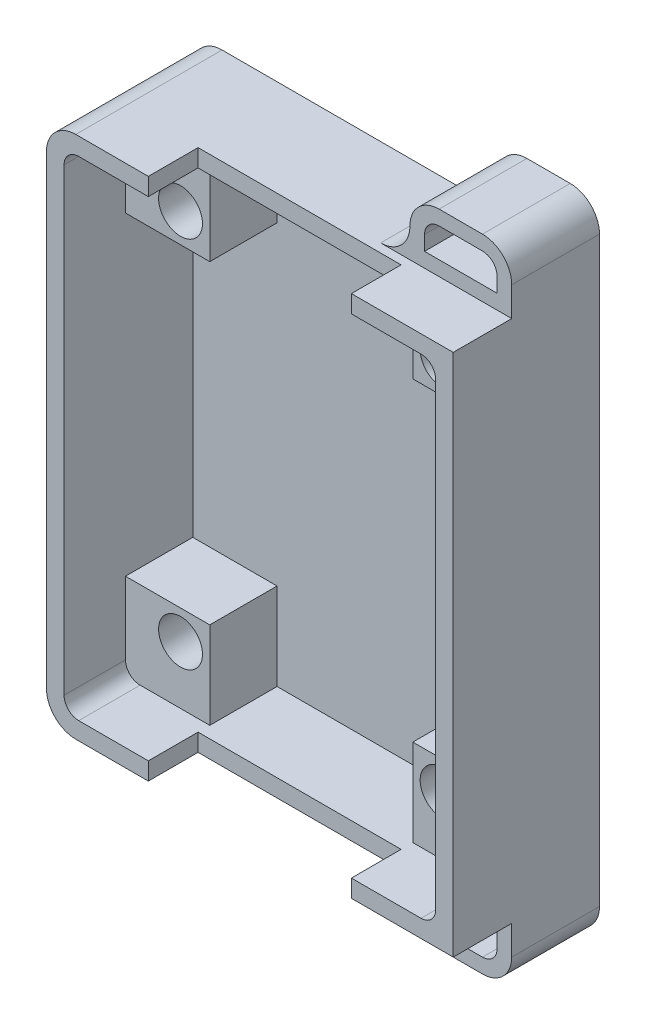
from build123d import *

# Parameters (mm, degrees)
SKIZZE1_W         = 27.8
SKIZZE1_H         = 35.8
EXTRUSION1_DEPTH  = 12
SKIZZE2_W         = 25.4
SKIZZE2_H         = 33.4
EXTRUSION2_DEPTH  = 10.8
SKIZZE3_R         = 1.5
EXTRUSION3_DEPTH  = 10.8
EXTRUSION4_START  = 6.6
SKIZZE4_W         = 5.76
SKIZZE4_H         = 5.95
SKIZZE4_R         = 1.5
EXTRUSION4_DEPTH  = 6.6
SKIZZE5_W         = 13.88
SKIZZE5_H         = 3.4
EXTRUSION5_DEPTH  = 47.887951544
EXTRUSION6_DEPTH  = 2
SKIZZE7_W         = 27.8
SKIZZE7_H         = 35.8
EXTRUSION7_DEPTH  = 2
SKIZZE8_W         = 6.96
SKIZZE8_H         = 6
EXTRUSION8_DEPTH  = 4
SKIZZE9_W         = 4.96
SKIZZE9_H         = 2
EXTRUSION9_DEPTH  = 50.566924456
SKIZZE10_W        = 6.96
SKIZZE10_H        = 4
SKIZZE10_W_2      = 4.96
SKIZZE10_H_2      = 2
EXTRUSION10_DEPTH = 6
RUNDUNG1_R        = 2
RUNDUNG2_R        = 1
RUNDUNG3_R        = 1
SKIZZE11_R        = 1.5
EXTRUSION11_DEPTH = 10


with BuildPart() as part:
    # Skizze1 → Extrusion1 (new body)
    with BuildSketch(Plane.XY):
        with Locations((13.9, -17.9)):
            Rectangle(SKIZZE1_W, SKIZZE1_H)
    extrude(amount=EXTRUSION1_DEPTH)

    # Skizze2 → Extrusion2 (cut)
    with BuildSketch(Plane.XY.offset(12)):
        with Locations((13.9, -17.9)):
            Rectangle(SKIZZE2_W, SKIZZE2_H)
    extrude(amount=-EXTRUSION2_DEPTH, mode=Mode.SUBTRACT)

    # Skizze3 → Extrusion3 (cut)
    with BuildSketch(Plane.XY.offset(1.2)):
        with Locations((22.84, -30.65)):
            Circle(SKIZZE3_R)
        with Locations((4.96, -30.65)):
            Circle(SKIZZE3_R)
        with Locations((22.84, -5.15)):
            Circle(SKIZZE3_R)
        with Locations((4.96, -5.15)):
            Circle(SKIZZE3_R)
    extrude(amount=-EXTRUSION3_DEPTH, mode=Mode.SUBTRACT)

    # Skizze4 → Extrusion4 (add)
    # profile 1 of 4: a face of its own
    with BuildSketch(Plane.XY.offset(1.2).offset(EXTRUSION4_START)):
        with Locations((4.08, -4.175)):
            Rectangle(SKIZZE4_W, SKIZZE4_H)
        with Locations((4.96, -5.15)):
            Circle(SKIZZE4_R, mode=Mode.SUBTRACT)
    # profile 2 of 4: a face of its own
    with BuildSketch(Plane.XY.offset(1.2).offset(EXTRUSION4_START)):
        with Locations((23.72, -4.175)):
            Rectangle(SKIZZE4_W, SKIZZE4_H)
        with Locations((22.84, -5.15)):
            Circle(SKIZZE4_R, mode=Mode.SUBTRACT)
    # profile 3 of 4: a face of its own
    with BuildSketch(Plane.XY.offset(1.2).offset(EXTRUSION4_START)):
        with Locations((23.72, -31.625)):
            Rectangle(SKIZZE4_W, SKIZZE4_H)
        with Locations((22.84, -30.65)):
            Circle(SKIZZE4_R, mode=Mode.SUBTRACT)
    # profile 4 of 4: a face of its own
    with BuildSketch(Plane.XY.offset(1.2).offset(EXTRUSION4_START)):
        with Locations((4.08, -31.625)):
            Rectangle(SKIZZE4_W, SKIZZE4_H)
        with Locations((4.96, -30.65)):
            Circle(SKIZZE4_R, mode=Mode.SUBTRACT)
    extrude(amount=-EXTRUSION4_DEPTH)

    # Skizze5 → Extrusion5 (cut, through all)
    with BuildSketch(Plane(origin=(0, 0, 0), x_dir=(-1, 0, 0), z_dir=(0, 1, 0))):
        with Locations((-13.9, 10.3)):
            Rectangle(SKIZZE5_W, SKIZZE5_H)
    extrude(amount=-EXTRUSION5_DEPTH, mode=Mode.SUBTRACT)

    # Skizze6 → Extrusion6 (add)
    with BuildSketch(Plane.XY.offset(1.2)):
        Polygon((26.6, -1.2), (1.2, -1.2), (1.2, -34.6), (20.84, -34.6), (26.6, -34.6), align=None)
    extrude(amount=EXTRUSION6_DEPTH)

    # Skizze7 → Extrusion7 (cut)
    with BuildSketch(Plane(origin=(0, 0, 0), x_dir=(-1, 0, 0), z_dir=(0, 0, -1))):
        with Locations((-13.9, -17.9)):
            Rectangle(SKIZZE7_W, SKIZZE7_H)
    extrude(amount=-EXTRUSION7_DEPTH, mode=Mode.SUBTRACT)

    # Skizze8 → Extrusion8 (add)
    with BuildSketch(Plane.XZ.offset(35.8)):
        with Locations((24.32, 5)):
            Rectangle(SKIZZE8_W, SKIZZE8_H)
    extrude(amount=EXTRUSION8_DEPTH)

    # Skizze9 → Extrusion9 (cut, through all)
    with BuildSketch(Plane(origin=(0, 0, 2), x_dir=(-1, 0, 0), z_dir=(0, 0, -1))):
        with Locations((-24.32, -37.8)):
            Rectangle(SKIZZE9_W, SKIZZE9_H)
    extrude(amount=-EXTRUSION9_DEPTH, mode=Mode.SUBTRACT)

    # Skizze10 → Extrusion10 (add)
    with BuildSketch(Plane(origin=(0, 0, 2), x_dir=(-1, 0, 0), z_dir=(0, 0, -1))):
        with Locations((-24.32, 2)):
            Rectangle(SKIZZE10_W, SKIZZE10_H)
        with Locations((-24.32, 2)):
            Rectangle(SKIZZE10_W_2, SKIZZE10_H_2, mode=Mode.SUBTRACT)
    extrude(amount=-EXTRUSION10_DEPTH)

    # Rundung1
    rundung1_edges = [part.edges().sort_by_distance(p)[0] for p in [
        (0, 0, 7),
        (0, -35.8, 7),
        (20.84, -39.8, 5),
        (27.8, -39.8, 5),
        (20.84, 4, 5),
        (27.8, 4, 5),
        (20.84, -35.8, 5),
        (20.84, 0, 5),
    ]]
    fillet(rundung1_edges, radius=RUNDUNG1_R - 0.0001)  # a hair under: the kernel refuses the full size

    # Rundung2
    rundung2_edges = [part.edges().sort_by_distance(p)[0] for p in [
        (1.2, -1.2, 9.9),
        (26.6, -1.2, 9.9),
        (26.6, -34.6, 9.9),
        (1.2, -34.6, 9.9),
    ]]
    fillet(rundung2_edges, radius=RUNDUNG2_R)

    # Rundung3
    rundung3_edges = [part.edges().sort_by_distance(p)[0] for p in [
        (26.8, -38.8, 5),
        (21.84, -38.8, 5),
        (21.84, 3, 5),
        (26.8, 3, 5),
    ]]
    fillet(rundung3_edges, radius=RUNDUNG3_R)

    # Skizze11 → Extrusion11 (cut)
    with BuildSketch(Plane.XY.offset(7.8)):
        with Locations((4.96, -5.15)):
            Circle(SKIZZE11_R)
        with Locations((22.84, -5.15)):
            Circle(SKIZZE11_R)
        with Locations((4.96, -30.65)):
            Circle(SKIZZE11_R)
        with Locations((22.84, -30.65)):
            Circle(SKIZZE11_R)
    extrude(amount=-EXTRUSION11_DEPTH, mode=Mode.SUBTRACT)


solid = part.part
